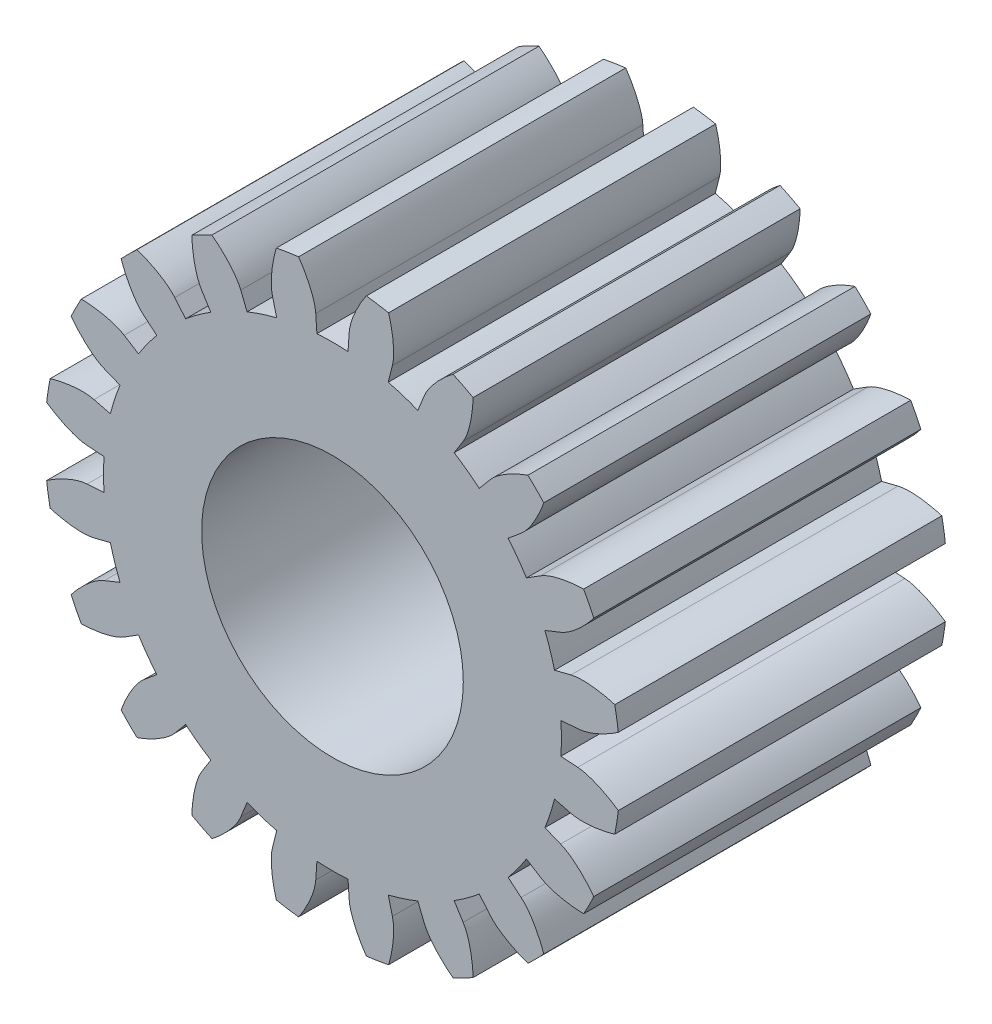
from build123d import *

# Parameters (mm, degrees)
SKETCH_1_R               = 2.2
SKETCH_1_R_2             = 1
EXTRUDE_1_DEPTH          = 2.5
CUT_EXTRUDE_1_DEPTH      = 4.991240409
PATTERN_CIRCULAR_1_COUNT = 20
PATTERN_CIRCULAR_1_ANGLE = 342


with BuildPart() as part:
    # 草图1 → 凸台-拉伸1 (new body)
    with BuildSketch(Plane.XY):
        Circle(SKETCH_1_R)
        Circle(SKETCH_1_R_2, mode=Mode.SUBTRACT)
    extrude(amount=EXTRUDE_1_DEPTH)

    # 草图1<3> → 切除-拉伸1 (cut, through all)
    with BuildSketch(Plane.XY):
        with BuildLine():
            Line((1.875038496, 0.127747889), (1.745952504, 0.118953156))
            ThreePointArc((1.745952504, 0.118953156), (1.748987833, 0.059510998), (1.75, 0))
            ThreePointArc((1.75, 0), (1.748987833, -0.059510998), (1.745952504, -0.118953156))
            Line((1.745952504, -0.118953156), (1.875038496, -0.127747889))
            add(Edge.make_bspline(
                [(1.875038496, -0.127747889), (1.889331408, -0.128721676), (1.929015864, -0.134409782), (2.002495743, -0.157024988), (2.079657128, -0.192996565), (2.140439093, -0.229140118), (2.177678908, -0.254137881), (2.184706013, -0.258958755)],
                knots=[0, 0, 0, 0, 0, 0.005604068, 0.015718248, 0.029959916, 0.033300539, 0.033300539, 0.033300539, 0.033300539, 0.033300539], degree=4))
            ThreePointArc((2.184706013, -0.258958755), (2.196173175, -0.129704995), (2.2, 0))
            ThreePointArc((2.2, 0), (2.196173175, 0.129704995), (2.184706013, 0.258958755))
            add(Edge.make_bspline(
                [(1.875038496, 0.127747889), (1.889331408, 0.128721676), (1.929015864, 0.134409782), (2.002495743, 0.157024988), (2.079657128, 0.192996565), (2.140439093, 0.229140118), (2.177678908, 0.254137881), (2.184706013, 0.258958755)],
                knots=[0, 0, 0, 0, 0, 0.005604068, 0.015718248, 0.029959916, 0.033300539, 0.033300539, 0.033300539, 0.033300539, 0.033300539], degree=4))
        make_face()
    cut_extrude_1 = extrude(amount=CUT_EXTRUDE_1_DEPTH, mode=Mode.SUBTRACT)

    # 阵列(圆周)1: 切除-拉伸1 ×20 about axis
    pattern_circular_1_axis = Axis((0, 0, 2.5), (0, 0, 1))
    for i in range(1, PATTERN_CIRCULAR_1_COUNT):
        add(cut_extrude_1.rotate(pattern_circular_1_axis, i * PATTERN_CIRCULAR_1_ANGLE / (PATTERN_CIRCULAR_1_COUNT - 1)), mode=Mode.SUBTRACT)


solid = part.part
